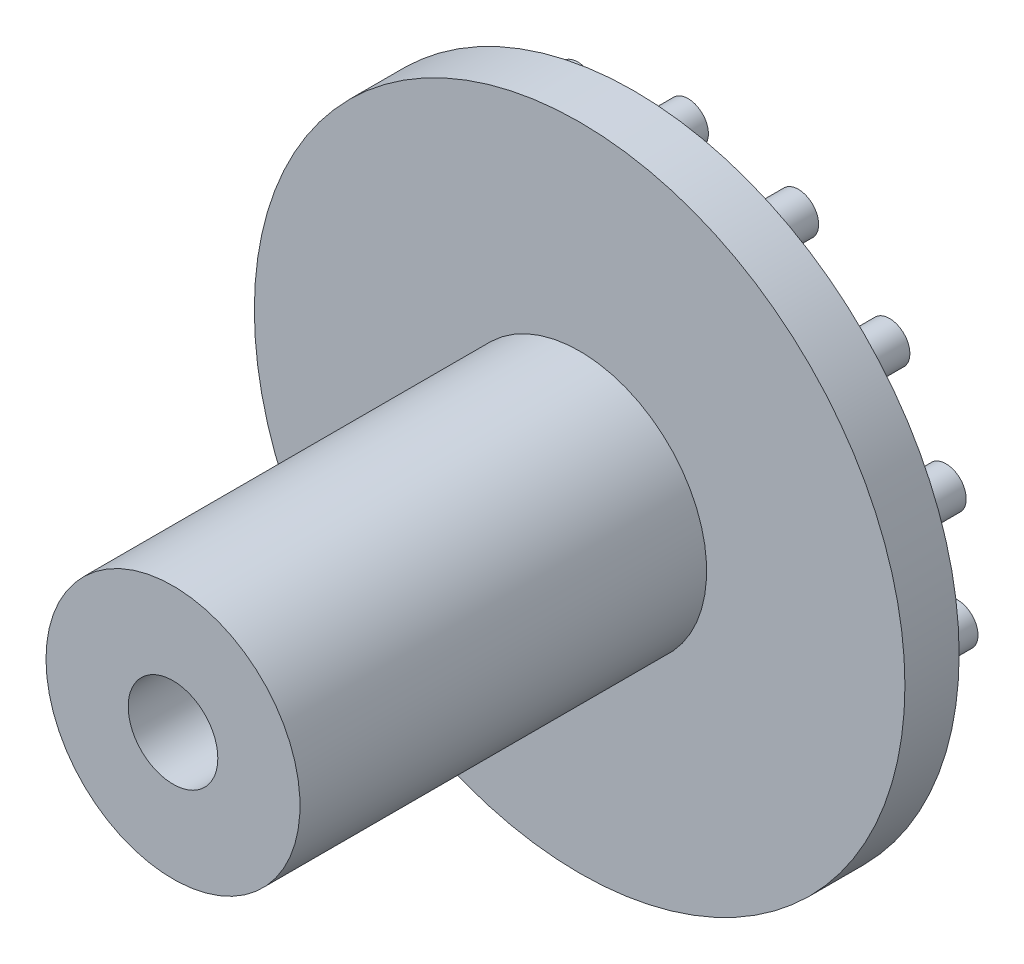
from build123d import *

# Parameters (mm, degrees)
SKETCH1_R             = 15.24
SKETCH1_R_2           = 4.55
BOSS_EXTRUDE1_DEPTH   = 2.54
SKETCH2_R             = 5.95
BOSS_EXTRUDE2_DEPTH   = 19.05
SKETCH5_R             = 0.9525
BOSS_EXTRUDE5_DEPTH   = 2.54
M5X0_8_TAPPED_HOLE2_D = 4.2


with BuildPart() as part:
    # Sketch1 → Boss-Extrude1 (new body)
    with BuildSketch(Plane.XY):
        Circle(SKETCH1_R)
        Circle(SKETCH1_R_2, mode=Mode.SUBTRACT)
    extrude(amount=BOSS_EXTRUDE1_DEPTH)

    # Sketch2 → Boss-Extrude2 (add)
    with BuildSketch(Plane.XY.offset(2.54)):
        Circle(SKETCH2_R)
    extrude(amount=BOSS_EXTRUDE2_DEPTH)

    # Sketch5 → Boss-Extrude5 (add)
    with BuildSketch(Plane(origin=(0, 0, 0), x_dir=(-1, 0, 0), z_dir=(0, 0, -1))):
        with Locations((0, 12.7)):
            Circle(SKETCH5_R)
        with Locations((5.165555367, 11.602027312)):
            Circle(SKETCH5_R)
        with Locations((9.437939284, 8.497958701)):
            Circle(SKETCH5_R)
        with Locations((12.078417757, 3.924515829)):
            Circle(SKETCH5_R)
        with Locations((12.630428071, -1.327511483)):
            Circle(SKETCH5_R)
        with Locations((10.998522628, -6.35)):
            Circle(SKETCH5_R)
        with Locations((7.464872704, -10.274515829)):
            Circle(SKETCH5_R)
        with Locations((2.640478473, -12.422474529)):
            Circle(SKETCH5_R)
        with Locations((-2.640478473, -12.422474529)):
            Circle(SKETCH5_R)
        with Locations((-7.464872704, -10.274515829)):
            Circle(SKETCH5_R)
        with Locations((-10.998522628, -6.35)):
            Circle(SKETCH5_R)
        with Locations((-12.630428071, -1.327511483)):
            Circle(SKETCH5_R)
        with Locations((-12.078417757, 3.924515829)):
            Circle(SKETCH5_R)
        with Locations((-9.437939284, 8.497958701)):
            Circle(SKETCH5_R)
        with Locations((-5.165555367, 11.602027312)):
            Circle(SKETCH5_R)
    extrude(amount=BOSS_EXTRUDE5_DEPTH)

    # M5x0.8 Tapped Hole2 (through all)
    with Locations(Plane.XY.offset(21.59)):
        with Locations((0, 0)):
            Hole(M5X0_8_TAPPED_HOLE2_D / 2)


solid = part.part
